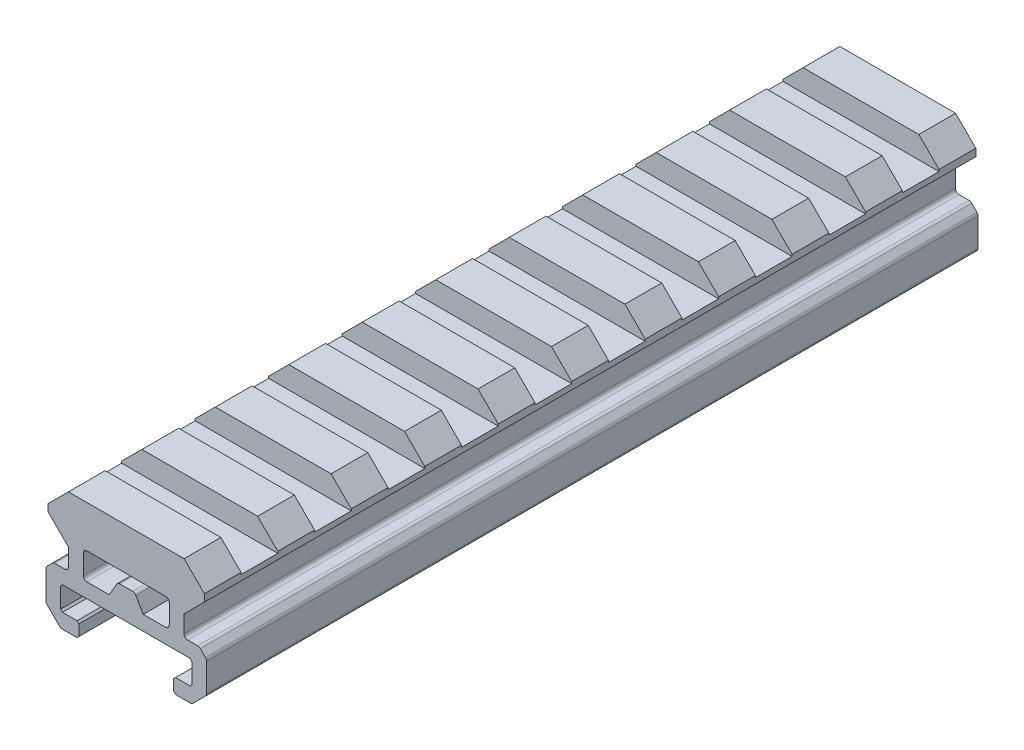
from build123d import *

# Parameters (mm, degrees)
BOSS_EXTRUDE1_DEPTH     = 105
CUT_EXTRUDE1_DEPTH      = 107.175223687
CUT_EXTRUDE1_DEPTH_BACK = 107.175223687
SKETCH2_W               = 5
SKETCH2_H               = 3
CUT_EXTRUDE2_REACH      = 108.175
CHAMFER1_SIZE           = 0.25
FILLET1_R               = 0.5


with BuildPart() as part:
    # Sketch1 → Boss-Extrude1 (new body)
    with BuildSketch(Plane.XY):
        Polygon((7.875, 11.35), (10.625, 8.6), (10.625, 7.6), (7.875, 4.85), (7.85, 4.85), (7.85, 2), (9.925, 2), (10.925, 1), (10.925, -3.25), (8.924999043, -5.25), (6.45, -5.25), (6.45, -3.25), (8.925, -3.25), (8.925, 0), (-8.925, 0), (-8.925, -3.25), (-6.45, -3.25), (-6.45, -5.25), (-8.924999043, -5.25), (-10.925, -3.25), (-10.925, 1), (-9.925, 2), (-7.85, 2), (-7.85, 4.85), (-7.875, 4.85), (-10.625, 7.6), (-10.625, 8.6), (-7.875, 11.35), align=None)
    extrude(amount=BOSS_EXTRUDE1_DEPTH)

    # Sketch2 → Cut-Extrude1 (cut, two sides: drawn at the far end of the back side and taken through both)
    with BuildSketch(Plane(origin=(0, 0, 0), x_dir=(0, 0, -1), z_dir=(1, 0, 0)).offset(-CUT_EXTRUDE1_DEPTH_BACK)):
        with Locations((2.5, 9.85)):
            Rectangle(SKETCH2_W, SKETCH2_H)
        with Locations((-7.5, 9.85)):
            Rectangle(SKETCH2_W, SKETCH2_H)
        with Locations((-17.5, 9.85)):
            Rectangle(SKETCH2_W, SKETCH2_H)
        with Locations((-27.5, 9.85)):
            Rectangle(SKETCH2_W, SKETCH2_H)
        with Locations((-37.5, 9.85)):
            Rectangle(SKETCH2_W, SKETCH2_H)
        with Locations((-47.5, 9.85)):
            Rectangle(SKETCH2_W, SKETCH2_H)
        with Locations((-57.5, 9.85)):
            Rectangle(SKETCH2_W, SKETCH2_H)
        with Locations((-67.5, 9.85)):
            Rectangle(SKETCH2_W, SKETCH2_H)
        with Locations((-77.5, 9.85)):
            Rectangle(SKETCH2_W, SKETCH2_H)
        with Locations((-87.5, 9.85)):
            Rectangle(SKETCH2_W, SKETCH2_H)
        with Locations((-97.5, 9.85)):
            Rectangle(SKETCH2_W, SKETCH2_H)
    extrude(amount=CUT_EXTRUDE1_DEPTH + CUT_EXTRUDE1_DEPTH_BACK, mode=Mode.SUBTRACT)

    # Sketch3 → Cut-Extrude2 (cut, up to next)
    with BuildSketch(Plane.XY, mode=Mode.PRIVATE) as cut_extrude2_sk1:
        Polygon((1.154700538, 4), (2.309401077, 2), (5.85, 2), (5.85, 5.653427125), (-5.85, 5.653427125), (-5.85, 2), (-2.309401077, 2), (-1.154700538, 4), align=None)
    cut_extrude2_tool1 = extrude(cut_extrude2_sk1.sketch, amount=CUT_EXTRUDE2_REACH, mode=Mode.PRIVATE) & part.part
    add(cut_extrude2_tool1.solids().sort_by_distance((0, 4.008121, 0))[0], mode=Mode.SUBTRACT)

    # Chamfer1
    chamfer1_edges = [part.edges().sort_by_distance(p)[0] for p in [
        (8.925, 0, 52.5),
        (8.925, -3.25, 52.5),
        (6.45, -3.25, 52.5),
        (6.45, -5.25, 52.5),
        (-8.925, 0, 52.5),
        (-8.925, -3.25, 52.5),
        (-6.45, -3.25, 52.5),
        (-6.45, -5.25, 52.5),
    ]]
    chamfer(chamfer1_edges, length=CHAMFER1_SIZE)

    # Fillet1
    fillet1_edges = [part.edges().sort_by_distance(p)[0] for p in [
        (-8.924999043, -5.25, 52.5),
        (-10.925, -3.25, 52.5),
        (8.924999043, -5.25, 52.5),
        (10.925, -3.25, 52.5),
        (10.925, 1, 52.5),
        (9.925, 2, 52.5),
        (-10.925, 1, 52.5),
        (-9.925, 2, 52.5),
        (-7.85, 2, 52.5),
        (7.85, 2, 52.5),
        (-5.85, 5.653427125, 52.5),
        (-5.85, 2, 52.5),
        (5.85, 2, 52.5),
        (5.85, 5.653427125, 52.5),
        (-1.154700538, 4, 52.5),
        (1.154700538, 4, 52.5),
    ]]
    fillet(fillet1_edges, radius=FILLET1_R)


solid = part.part
